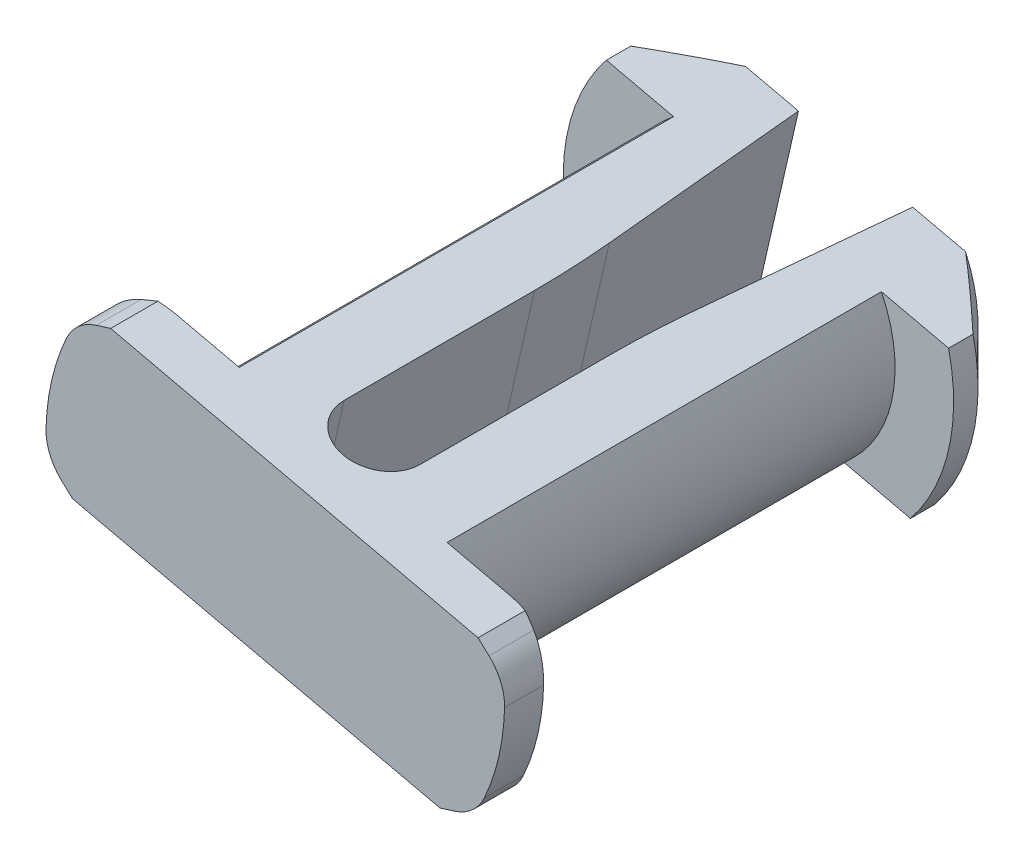
from build123d import *

# Parameters (mm, degrees)
BOSS_EXTRUDE1_DEPTH     = 1
CHAMFER1_SIZE           = 0.5
FILLET1_R               = 1
BOSS_EXTRUDE2_DEPTH     = 8.9
BOSS_EXTRUDE3_DEPTH     = 1.6
CUT_EXTRUDE1_DEPTH      = 63.654658492
CUT_EXTRUDE1_DEPTH_BACK = 63.654658492
FILLET2_R               = 20
FILLET3_R               = 0.8


# Some blends are built 0.0001 mm under size
with BuildPart() as part:
    # Sketch3 → Boss-Extrude1 (new body)
    with BuildSketch(Plane.XY.offset(7.5)):
        with BuildLine():
            Line((-59.471397705, 15.416079883), (-50.967479146, 13.468422533))
            ThreePointArc((-50.967479146, 13.468422533), (-51.028748516, 11.687143573), (-51.748854552, 10.056758353))
            Line((-51.748854552, 10.056758353), (-60.252773111, 12.004415704))
            ThreePointArc((-60.252773111, 12.004415704), (-60.191503741, 13.785694664), (-59.471397705, 15.416079883))
        make_face()
    extrude(amount=-BOSS_EXTRUDE1_DEPTH)

    # Chamfer1
    # the kernel refuses this chamfer: 0.5, 0.404802776 mm, written as the material it takes off along each edge
    with BuildSketch(Plane(origin=(-59.471397705, 15.416079883, 8.793542877), x_dir=(0.9747611941912204, -0.2232501160109568, 0), z_dir=(0, 0, -1))) as chamfer1_piece_1:
        with BuildLine():
            Line((CHAMFER1_SIZE, 0), (-0.128607842, 0.362926907))
            ThreePointArc((-0.128607842, 0.362926907), (-0.070555149, 0.18731274), (0, 0))
            Line((0, 0), (CHAMFER1_SIZE, 0))
        make_face()
    extrude(amount=3.587085755, mode=Mode.SUBTRACT)
    with BuildSketch(Plane(origin=(-50.967479146, 13.468422533, 8.793542877), x_dir=(-0.9747611941912215, 0.22325011601095288, 0), z_dir=(0, 0, -1)), Plane(origin=(-60.252773111, 12.004415704, 8.793542877), x_dir=(0.9747611941912214, -0.22325011601095318, 0), z_dir=(0, 0, -1))) as chamfer1_piece_2:
        with BuildLine():
            Line((CHAMFER1_SIZE, 0), (-0.128607842, -0.362926907))
            ThreePointArc((-0.128607842, -0.362926907), (-0.070555149, -0.18731274), (0, 0))
            Line((0, 0), (CHAMFER1_SIZE, 0))
        make_face()
    extrude(amount=3.587085755, mode=Mode.SUBTRACT)
    with BuildSketch(Plane(origin=(-51.748854552, 10.056758353, 8.793542877), x_dir=(0.5360100963407745, 0.8442115710061985, 0), z_dir=(0, 0, -1))) as chamfer1_piece_3:
        with BuildLine():
            Line((0.385040149, 0), (-CHAMFER1_SIZE * 0.334011510443, -CHAMFER1_SIZE * 0.942568995295))
            Line((-CHAMFER1_SIZE * 0.334011510443, -CHAMFER1_SIZE * 0.942568995295), (0, 0))
            ThreePointArc((0, 0), (0.200121413, 0.003938485), (0.385040149, 0))
        make_face()
    extrude(amount=3.587085755, mode=Mode.SUBTRACT)

    # Fillet1
    fillet1_edges = [part.edges().sort_by_distance(p)[0] for p in [
        (-50.923140687, 13.085943752, 7),
        (-51.542469145, 10.381813703, 7),
        (-59.677783112, 15.091024534, 7),
        (-60.29711157, 12.386894484, 7),
    ]]
    fillet(fillet1_edges, radius=FILLET1_R)

    # Sketch5 → Cut-Revolve1 (revolve, cut)
    with BuildSketch(Plane(origin=(0, 0, 0), x_dir=(0.9747611941912216, -0.22325011601095204, 0), z_dir=(0.22325011601095204, 0.9747611941912216, 0))):
        with BuildLine():
            Line((-60.95, -6.5), (-61.75, -6.5))
            Line((-61.75, -6.5), (-61.75, -6.7))
            ThreePointArc((-61.75, -6.7), (-61.362310563, -6.55075775), (-60.95, -6.5))
        make_face()
    revolve(axis=Axis((-55.610126129, 12.736419118, 6.5), (0, 0, 1)), mode=Mode.SUBTRACT)

    # Sketch6 → Boss-Extrude2 (add)
    with BuildSketch(Plane(origin=(0, 0, 6.5), x_dir=(-1, 0, 0), z_dir=(0, 0, -1))):
        with BuildLine():
            Line((58.131397429, 11.518555813), (56.780622787, 11.209187121))
            Line((56.780622787, 11.209187121), (55.999247381, 14.620851301))
            Line((55.999247381, 14.620851301), (57.350022023, 14.930219993))
            ThreePointArc((57.350022023, 14.930219993), (58.339457472, 13.361519443), (58.131397429, 11.518555813))
        make_face()
        with BuildLine():
            Line((55.221004876, 10.851986936), (53.870230234, 10.542618244))
            ThreePointArc((53.870230234, 10.542618244), (52.880794785, 12.111318794), (53.088854828, 13.954282424))
            Line((53.088854828, 13.954282424), (54.43962947, 14.263651115))
            Line((54.43962947, 14.263651115), (55.221004876, 10.851986936))
        make_face()
    extrude(amount=BOSS_EXTRUDE2_DEPTH)

    # Sketch7 → Boss-Extrude3 (add)
    with BuildSketch(Plane(origin=(0, 0, -2.4), x_dir=(-1, 0, 0), z_dir=(0, 0, -1))):
        with BuildLine():
            Line((54.43962947, 14.263651115), (51.713345578, 13.63924875))
            ThreePointArc((51.713345578, 13.63924875), (51.711081352, 11.843418654), (52.494720985, 10.227584571))
            Line((52.494720985, 10.227584571), (55.221004876, 10.851986936))
            Line((55.221004876, 10.851986936), (54.43962947, 14.263651115))
        make_face()
        with BuildLine():
            Line((55.999247381, 14.620851301), (58.725531273, 15.245253666))
            ThreePointArc((58.725531273, 15.245253666), (59.509170905, 13.629419582), (59.506906679, 11.833589487))
            Line((59.506906679, 11.833589487), (56.780622787, 11.209187121))
            Line((56.780622787, 11.209187121), (55.999247381, 14.620851301))
        make_face()
    extrude(amount=BOSS_EXTRUDE3_DEPTH)

    # Sketch8 → Cut-Revolve2 (revolve, cut)
    with BuildSketch(Plane(origin=(0, 0, 0), x_dir=(0.9747611941912216, -0.22325011601095204, 0), z_dir=(0.22325011601095204, 0.9747611941912216, 0))):
        Polygon((-61.05, 2.9), (-59.95, 4), (-61.05, 4), align=None)
    revolve(axis=Axis((-55.610126129, 12.736419118, 6.5), (0, 0, 1)), mode=Mode.SUBTRACT)

    # Sketch9 → Cut-Extrude1 (cut, two sides: drawn at the far end of the back side and taken through both)
    with BuildSketch(Plane(origin=(0.390687703, 1.70583209, 0), x_dir=(0.9747611941912216, -0.22325011601095204, 0), z_dir=(0.22325011601095204, 0.9747611941912216, 0)).offset(-CUT_EXTRUDE1_DEPTH_BACK)):
        Polygon((-58.25, 4), (-57.85, -1), (-57.85, 4), align=None)
        Polygon((-55.85, 4), (-56.25, -1), (-56.25, 4), align=None)
    extrude(amount=CUT_EXTRUDE1_DEPTH + CUT_EXTRUDE1_DEPTH_BACK, mode=Mode.SUBTRACT)

    # Fillet2
    # the kernel refuses this fillet: 20 mm, written as the material it takes off along each edge
    with BuildSketch(Plane(origin=(-53.993841362, 16.21006421, 1), x_dir=(0, 0, 1), z_dir=(-0.22325011601095204, -0.9747611941912216, 0))) as fillet2_piece_1:
        with BuildLine():
            CenterArc((FILLET2_R * 0.0399362039845, -FILLET2_R), FILLET2_R, 90, 4.57392126)
            Line((-FILLET2_R * 0.0398090182984, -FILLET2_R * 0.00318472146388), (0, 0))
            Line((0, 0), (FILLET2_R * 0.0399362039845, 0))
        make_face()
    extrude(amount=7.493620398, mode=Mode.SUBTRACT)
    with BuildSketch(Plane(origin=(-57.226410896, 9.262774027, 1), x_dir=(-0.07773254810353018, 0.01780313012597799, -0.9968152785361237), z_dir=(0.223250116010952, 0.9747611941912216, 0))) as fillet2_piece_2:
        with BuildLine():
            CenterArc((FILLET2_R * 0.0399362039845, FILLET2_R), FILLET2_R, 265.42607874, 4.57392126)
            Line((-FILLET2_R * 0.0398090182984, FILLET2_R * 0.00318472146388), (0, 0))
            Line((0, 0), (FILLET2_R * 0.0399362039845, 0))
        make_face()
    extrude(amount=7.493620398, mode=Mode.SUBTRACT)

    # Fillet3
    fillet3_edges = [part.edges().sort_by_distance(p)[0] for p in [
        (-54.830317173, 12.557819026, 6.5),
        (-56.389935084, 12.915019211, 6.5),
    ]]
    fillet(fillet3_edges, radius=FILLET3_R - 0.0001)  # a hair under: the kernel refuses the full size


solid = part.part
